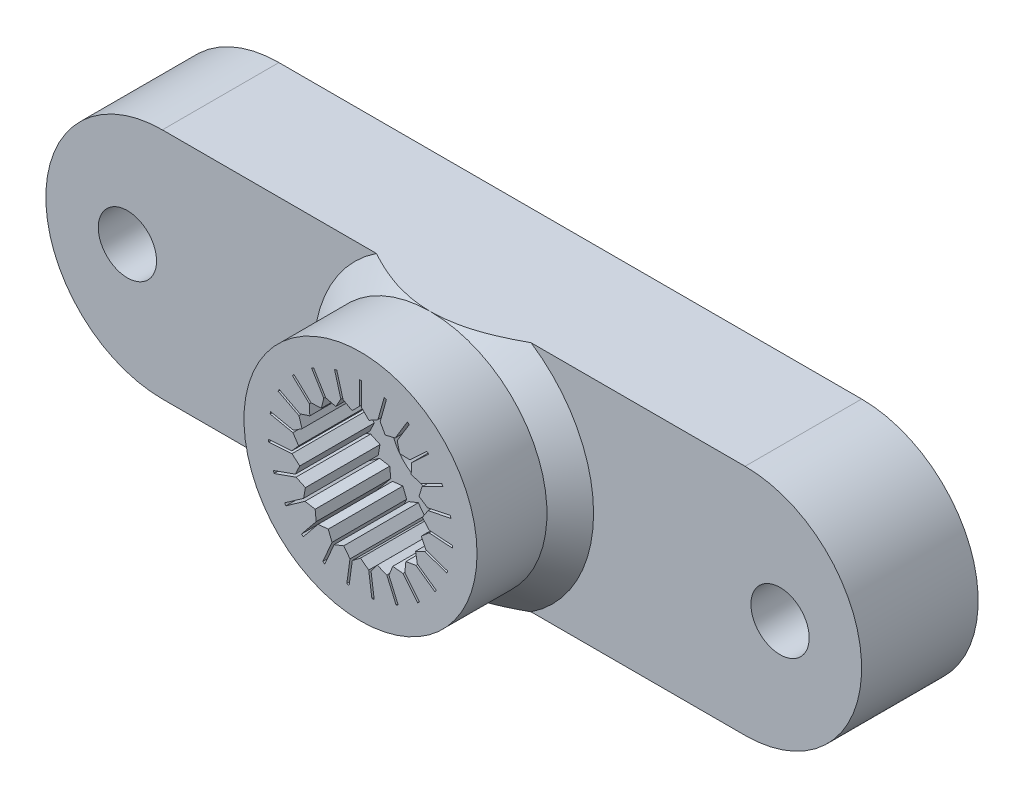
from build123d import *

# Parameters (mm, degrees)
EXTRUDE_1_DEPTH          = 5
SKETCH_6_R               = 5
EXTRUDE_3_DEPTH          = 4
CUT_EXTRUDE_5_DEPTH      = 3.2
CHAMFER_1_SIZE           = 1
CUT_EXTRUDE_6_DEPTH      = 21.303940504
CUT_EXTRUDE_6_DEPTH_BACK = 21.303940504
SKETCH_7_R               = 1.25
SKETCH_7_R_2             = 1.9


with BuildPart() as part:
    # ｽｹｯﾁ1 → ﾎﾞｽ - 押し出し1 (new body)
    with BuildSketch(Plane.XY):
        with BuildLine():
            Line((12.5, -5), (-12.5, -5))
            ThreePointArc((-12.5, -5), (-17.5, 0), (-12.5, 5))
            Line((-12.5, 5), (12.5, 5))
            ThreePointArc((12.5, 5), (17.5, 0), (12.5, -5))
        make_face()
    extrude(amount=EXTRUDE_1_DEPTH)

    # ｽｹｯﾁ6 → ﾎﾞｽ - 押し出し3 (add)
    with BuildSketch(Plane.XY.offset(5)):
        with Locations(Location((0, 0, 0), (0, 0, 270))):
            Circle(SKETCH_6_R)
    extrude(amount=EXTRUDE_3_DEPTH)

    # ｽｹｯﾁ5 → ｶｯﾄ - 押し出し5 (cut)
    with BuildSketch(Plane.XY.offset(9)):
        Polygon((-0.05, 2.95), (-0.05, 3.95), (0.05, 3.95), (0.05, 2.95), (0.362514094, 2.637485906), (0.747754611, 2.854095836), (1.017551382, 3.817013124), (1.11384311, 3.790033446), (0.844046339, 2.827116159), (1.060656269, 2.441875642), (1.490051682, 2.546516441), (2.009635632, 3.400935845), (2.095077573, 3.34897745), (1.575493623, 2.494558046), (1.680134421, 2.065162633), (2.121838437, 2.050073571), (2.852674402, 2.732626714), (2.920929716, 2.659543117), (2.190093752, 1.976989974), (2.17500469, 1.535285958), (2.596258142, 1.401586122), (3.484143361, 1.86165116), (3.530149865, 1.772862638), (2.642264646, 1.3127976), (2.50856481, 0.891544148), (2.878125258, 0.649149443), (3.857209346, 0.852605456), (3.877554947, 0.754697047), (2.898470859, 0.551241034), (2.656076155, 0.181680586), (2.94653499, -0.151431681), (3.944203759, -0.219674094), (3.937379518, -0.319440971), (2.939710748, -0.251198558), (2.606598481, -0.541657393), (2.796413701, -0.94078181), (3.738674623, -1.275661422), (3.705186662, -1.369887514), (2.76292574, -1.035007902), (2.363801323, -1.224823122), (2.4388952, -1.660358456), (3.255865093, -2.237038778), (3.198197061, -2.318735767), (2.381227168, -1.742055445), (1.945691834, -1.817149322), (1.900495, -2.25679391), (2.531582945, -3.032505201), (2.454011816, -3.095613995), (1.822923871, -2.319902705), (1.383279283, -2.274705871), (1.22114378, -2.685853285), (1.61954487, -3.603064586), (1.52782374, -3.642904695), (1.12942265, -2.725693394), (0.718275236, -2.563557891), (0.451225912, -2.915715208), (0.587392561, -3.906401154), (0.488323967, -3.920017819), (0.352157318, -2.929331873), (0, -2.66228255), (-0.352157318, -2.929331873), (-0.488323967, -3.920017819), (-0.587392561, -3.906401154), (-0.451225912, -2.915715208), (-0.718275236, -2.563557891), (-1.12942265, -2.725693394), (-1.52782374, -3.642904695), (-1.61954487, -3.603064586), (-1.22114378, -2.685853285), (-1.383279283, -2.274705871), (-1.822923871, -2.319902705), (-2.454011816, -3.095613995), (-2.531582945, -3.032505201), (-1.900495, -2.25679391), (-1.945691834, -1.817149322), (-2.381227168, -1.742055445), (-3.198197061, -2.318735767), (-3.255865093, -2.237038778), (-2.4388952, -1.660358456), (-2.363801323, -1.224823122), (-2.76292574, -1.035007902), (-3.705186662, -1.369887514), (-3.738674623, -1.275661422), (-2.796413701, -0.94078181), (-2.606598481, -0.541657393), (-2.939710748, -0.251198558), (-3.937379518, -0.319440971), (-3.944203759, -0.219674094), (-2.94653499, -0.151431681), (-2.656076155, 0.181680586), (-2.898470859, 0.551241034), (-3.877554947, 0.754697047), (-3.857209346, 0.852605456), (-2.878125258, 0.649149443), (-2.50856481, 0.891544148), (-2.642264646, 1.3127976), (-3.530149865, 1.772862638), (-3.484143361, 1.86165116), (-2.596258142, 1.401586122), (-2.17500469, 1.535285958), (-2.190093752, 1.976989974), (-2.920929716, 2.659543117), (-2.852674402, 2.732626714), (-2.121838437, 2.050073571), (-1.680134421, 2.065162633), (-1.575493623, 2.494558046), (-2.095077573, 3.34897745), (-2.009635632, 3.400935845), (-1.490051682, 2.546516441), (-1.060656269, 2.441875642), (-0.844046339, 2.827116159), (-1.11384311, 3.790033446), (-1.017551382, 3.817013124), (-0.747754611, 2.854095836), (-0.362514094, 2.637485906), align=None)
    extrude(amount=-CUT_EXTRUDE_5_DEPTH, mode=Mode.SUBTRACT)

    # 面取り1
    # the kernel refuses this chamfer: 1 mm, written as the material it adds along each edge
    with BuildSketch(Plane(origin=(0, 0, 5), x_dir=(0, -1, 0), z_dir=(-1, 0, 0))) as chamfer_1_piece_1_section:
        Polygon((5 + CHAMFER_1_SIZE, 0), (5, CHAMFER_1_SIZE), (5, 0), align=None)
    chamfer_1_piece_1 = revolve(axis=Axis((0, 0, 5), (0, 0, 1)), revolution_arc=180, mode=Mode.PRIVATE)
    chamfer_1_piece_1 = split(chamfer_1_piece_1, bisect_by=Plane(origin=(5.48673026, -5, 5.48673026), z_dir=(0, 1, 0)), keep=Keep.TOP, mode=Mode.PRIVATE)
    chamfer_1_piece_1 = split(chamfer_1_piece_1, bisect_by=Plane(origin=(5.48673026, 5, 5.48673026), z_dir=(0, -1, 0)), keep=Keep.TOP, mode=Mode.PRIVATE)
    add(chamfer_1_piece_1)
    with BuildSketch(Plane(origin=(0, 0, 5), x_dir=(0, 1, 0), z_dir=(1, 0, 0))) as chamfer_1_piece_2_section:
        Polygon((5 + CHAMFER_1_SIZE, 0), (5, CHAMFER_1_SIZE), (5, 0), align=None)
    chamfer_1_piece_2 = revolve(axis=Axis((0, 0, 5), (0, 0, 1)), revolution_arc=180, mode=Mode.PRIVATE)
    chamfer_1_piece_2 = split(chamfer_1_piece_2, bisect_by=Plane(origin=(-5.48673026, -5, 5.48673026), z_dir=(0, 1, 0)), keep=Keep.TOP, mode=Mode.PRIVATE)
    chamfer_1_piece_2 = split(chamfer_1_piece_2, bisect_by=Plane(origin=(-5.48673026, 5, 5.48673026), z_dir=(0, -1, 0)), keep=Keep.TOP, mode=Mode.PRIVATE)
    add(chamfer_1_piece_2)

    # ｽｹｯﾁ7 → ｶｯﾄ - 押し出し6 (cut, two sides: drawn at the far end of the back side and taken through both)
    with BuildSketch(Plane(origin=(0, 0, 0), x_dir=(-1, 0, 0), z_dir=(0, 0, -1)).offset(-CUT_EXTRUDE_6_DEPTH_BACK)):
        with Locations(Location((14, 0, 0), (0, 0, 180))):
            Circle(SKETCH_7_R)
        Circle(SKETCH_7_R_2)
        with Locations(Location((-14, 0, 0), (0, 0, 180))):
            Circle(SKETCH_7_R)
    extrude(amount=CUT_EXTRUDE_6_DEPTH + CUT_EXTRUDE_6_DEPTH_BACK, mode=Mode.SUBTRACT)


solid = part.part
